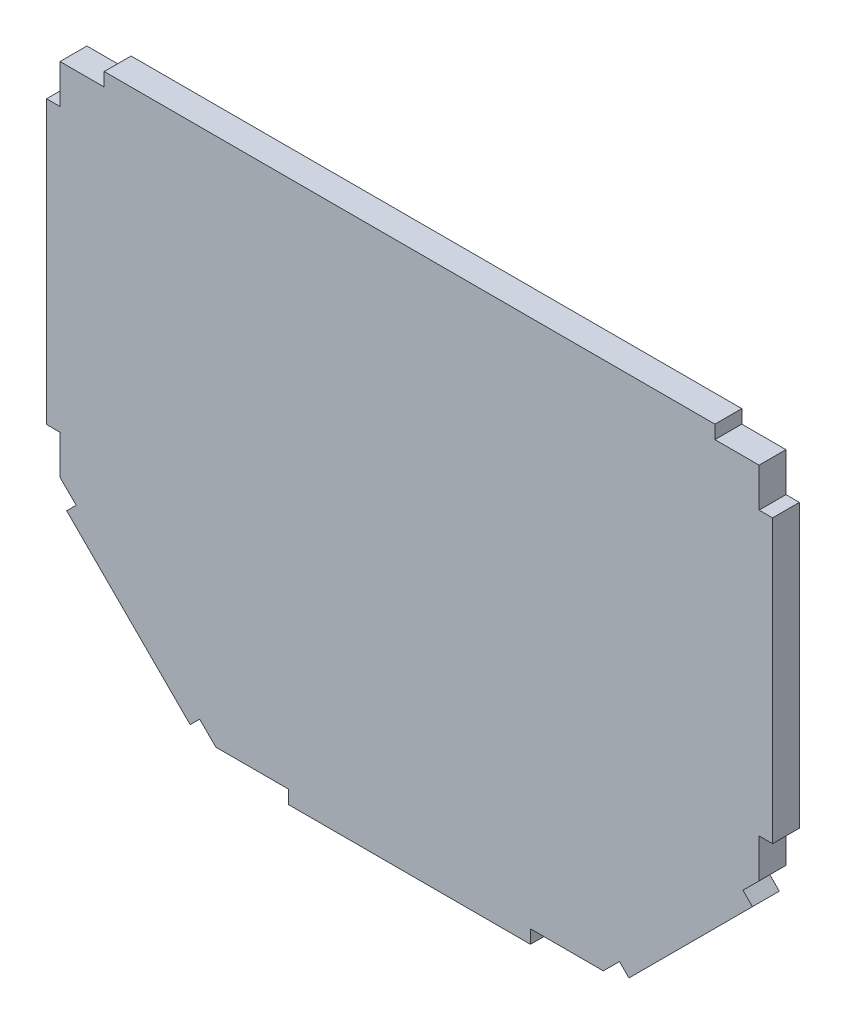
from build123d import *

# Parameters (mm, degrees)
BOSS_EXTRUDE1_DEPTH = 12.7


with BuildPart() as part:
    # Sketch2 → Boss-Extrude1 (new body)
    with BuildSketch(Plane.XY):
        Polygon((0, 0), (34.417, 0), (34.417, -6.35), (148.717, -6.35), (148.717, 0), (183.134, 0), (190.767217703, 7.633217703), (195.257345763, 3.143089642), (253.62901055, 61.514754429), (249.13888249, 66.00488249), (256.772100193, 73.638100193), (256.772100193, 92.053100193), (263.122100193, 92.053100193), (263.122100193, 225.403100193), (256.772100193, 225.403100193), (256.772100193, 243.818100193), (235.890518356, 243.818100193), (235.890518356, 250.168100193), (-52.756518356, 250.168100193), (-52.756518356, 243.818100193), (-73.638100193, 243.818100193), (-73.638100193, 225.403100193), (-79.988100193, 225.403100193), (-79.988100193, 92.053100193), (-73.638100193, 92.053100193), (-73.638100193, 73.638100193), (-66.00488249, 66.00488249), (-70.49501055, 61.514754429), (-12.123345763, 3.143089642), (-7.633217703, 7.633217703), align=None)
    extrude(amount=BOSS_EXTRUDE1_DEPTH)


solid = part.part
